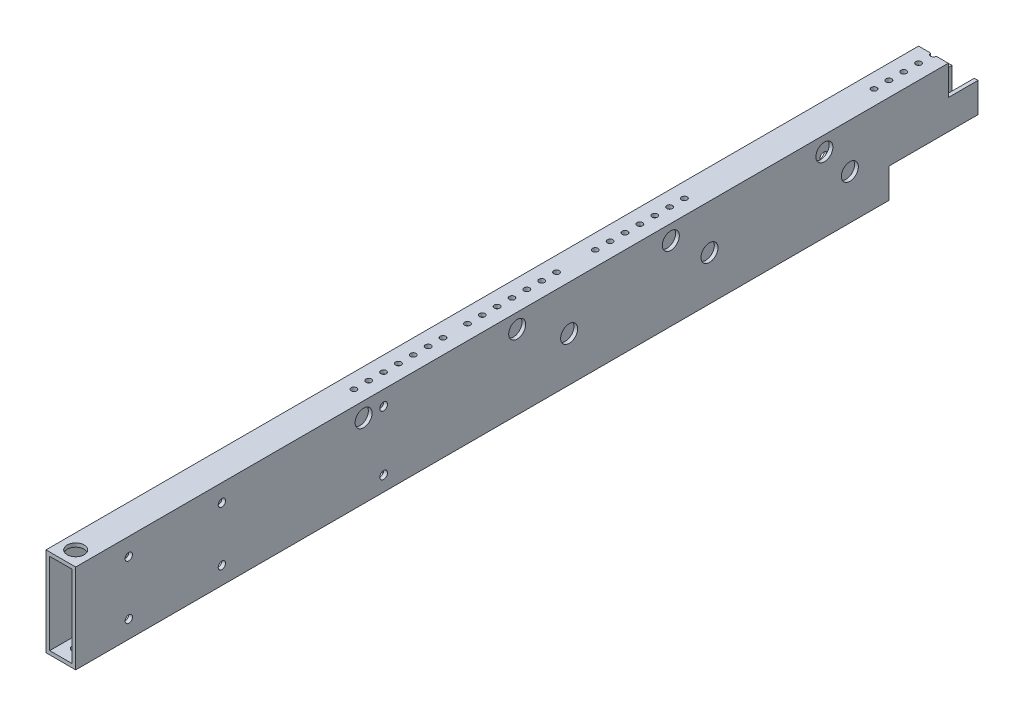
from build123d import *

# Parameters (mm, degrees)
SKETCH1_W                                    = 25.4
SKETCH1_H                                    = 76.2
BOSS_EXTRUDE1_DEPTH                          = 385.699
SHELL1_T                                     = -3.175
SKETCH2_W                                    = 76.2
SKETCH2_H                                    = 25.4
CUT_EXTRUDE1_DEPTH                           = 389.407632007
SKETCH3_W                                    = 25.4
SKETCH3_H                                    = 25.4
CUT_EXTRUDE2_DEPTH                           = 389.407632007
SKETCH4_R                                    = 2.38125
CUT_EXTRUDE3_DEPTH                           = 394.359185225
CUT_EXTRUDE4_REACH                           = 395.359
SKETCH5_R                                    = 2.38125
CUT_EXTRUDE5_REACH                           = 395.359
SKETCH6_R                                    = 2.38125
CBORE_FOR_M6_HEX_HEAD_BOLT1_D                = 6.3
CBORE_FOR_M6_HEX_HEAD_BOLT1_CBORE_D          = 14.547
CBORE_FOR_M6_HEX_HEAD_BOLT1_CBORE_DEPTH      = 4
CBORE_FOR_M6_HEX_HEAD_CAP_SCREW1_D           = 6.6
CBORE_FOR_M6_HEX_HEAD_CAP_SCREW1_CBORE_D     = 14.55
CBORE_FOR_M6_HEX_HEAD_CAP_SCREW1_CBORE_DEPTH = 4.15
CBORE_FOR_M6_HEX_HEAD_CAP_SCREW2_D           = 6.6
CBORE_FOR_M6_HEX_HEAD_CAP_SCREW2_CBORE_D     = 14.55
CBORE_FOR_M6_HEX_HEAD_CAP_SCREW2_CBORE_DEPTH = 4.15
CBORE_FOR_M6_HEX_HEAD_CAP_SCREW3_D           = 6.6
CBORE_FOR_M6_HEX_HEAD_CAP_SCREW3_CBORE_D     = 14.55
CBORE_FOR_M6_HEX_HEAD_CAP_SCREW3_CBORE_DEPTH = 4.15
CBORE_FOR_M6_HEX_HEAD_BOLT2_D                = 6.3
CBORE_FOR_M6_HEX_HEAD_BOLT2_CBORE_D          = 14.547
CBORE_FOR_M6_HEX_HEAD_BOLT2_CBORE_DEPTH      = 4


with BuildPart() as part:
    # Sketch1 → Boss-Extrude1 (new, symmetric)
    with BuildSketch(Plane.XY):
        Rectangle(SKETCH1_W, SKETCH1_H)
    extrude(amount=BOSS_EXTRUDE1_DEPTH, both=True)

    # Shell1
    shell1_openings = [part.faces().sort_by_distance(p)[0] for p in [
        (0, 0, -385.699),
        (0, 0, 385.699),
    ]]
    offset(amount=SHELL1_T, openings=shell1_openings, kind=Kind.INTERSECTION)

    # Sketch2 → Cut-Extrude1 (cut, through all)
    with BuildSketch(Plane(origin=(12.7, 0, 0), x_dir=(0, 0, -1), z_dir=(1, 0, 0))):
        with Locations((347.599, -25.4)):
            Rectangle(SKETCH2_W, SKETCH2_H)
    extrude(amount=-CUT_EXTRUDE1_DEPTH, mode=Mode.SUBTRACT)

    # Sketch3 → Cut-Extrude2 (cut, through all)
    with BuildSketch(Plane(origin=(12.7, 0, 0), x_dir=(0, 0, -1), z_dir=(1, 0, 0))):
        with Locations((372.999, 25.4)):
            Rectangle(SKETCH3_W, SKETCH3_H)
    extrude(amount=-CUT_EXTRUDE2_DEPTH, mode=Mode.SUBTRACT)

    # Sketch4 → Cut-Extrude3 (cut, through all)
    with BuildSketch(Plane(origin=(0, 38.1, 0), x_dir=(1, 0, 0), z_dir=(0, 1, 0))):
        with Locations((0, 147.394483214)):
            Circle(SKETCH4_R)
        with Locations((0, 134.694483214)):
            Circle(SKETCH4_R)
        with Locations((0, 121.994483214)):
            Circle(SKETCH4_R)
        with Locations((0, 109.294483214)):
            Circle(SKETCH4_R)
        with Locations((0, 96.594483214)):
            Circle(SKETCH4_R)
        with Locations((0, 83.894483214)):
            Circle(SKETCH4_R)
        with Locations((0, 71.194483214)):
            Circle(SKETCH4_R)
        with Locations((0, 38.09873)):
            Circle(SKETCH4_R)
        with Locations((0, 25.39873)):
            Circle(SKETCH4_R)
        with Locations((0, 12.69873)):
            Circle(SKETCH4_R)
        with Locations((0, -0.00127)):
            Circle(SKETCH4_R)
        with Locations((0, -12.70127)):
            Circle(SKETCH4_R)
        with Locations((0, -25.40127)):
            Circle(SKETCH4_R)
        with Locations((0, -38.10127)):
            Circle(SKETCH4_R)
        with Locations((0, -58.99324371)):
            Circle(SKETCH4_R)
        with Locations((0, -71.69324371)):
            Circle(SKETCH4_R)
        with Locations((0, -84.39324371)):
            Circle(SKETCH4_R)
        with Locations((0, -97.09324371)):
            Circle(SKETCH4_R)
        with Locations((0, -109.79324371)):
            Circle(SKETCH4_R)
        with Locations((0, -122.49324371)):
            Circle(SKETCH4_R)
        with Locations((0, -135.19324371)):
            Circle(SKETCH4_R)
    extrude(amount=-CUT_EXTRUDE3_DEPTH, mode=Mode.SUBTRACT)

    # Sketch5 → Cut-Extrude4 (cut, up to next)
    with BuildSketch(Plane(origin=(0, 38.1, 0), x_dir=(1, 0, 0), z_dir=(0, 1, 0)), mode=Mode.PRIVATE) as cut_extrude4_sk1:
        with Locations((0, 360.299)):
            Circle(SKETCH5_R)
    cut_extrude4_tool1 = extrude(cut_extrude4_sk1.sketch, amount=-CUT_EXTRUDE4_REACH, mode=Mode.PRIVATE) & part.part
    # Sketch5 → Cut-Extrude4 (cut, up to next)
    with BuildSketch(Plane(origin=(0, 38.1, 0), x_dir=(1, 0, 0), z_dir=(0, 1, 0)), mode=Mode.PRIVATE) as cut_extrude4_sk2:
        with Locations((0, 347.599)):
            Circle(SKETCH5_R)
    cut_extrude4_tool2 = extrude(cut_extrude4_sk2.sketch, amount=-CUT_EXTRUDE4_REACH, mode=Mode.PRIVATE) & part.part
    # Sketch5 → Cut-Extrude4 (cut, up to next)
    with BuildSketch(Plane(origin=(0, 38.1, 0), x_dir=(1, 0, 0), z_dir=(0, 1, 0)), mode=Mode.PRIVATE) as cut_extrude4_sk3:
        with Locations((0, 334.899)):
            Circle(SKETCH5_R)
    cut_extrude4_tool3 = extrude(cut_extrude4_sk3.sketch, amount=-CUT_EXTRUDE4_REACH, mode=Mode.PRIVATE) & part.part
    # Sketch5 → Cut-Extrude4 (cut, up to next)
    with BuildSketch(Plane(origin=(0, 38.1, 0), x_dir=(1, 0, 0), z_dir=(0, 1, 0)), mode=Mode.PRIVATE) as cut_extrude4_sk4:
        with Locations((0, 322.199)):
            Circle(SKETCH5_R)
    cut_extrude4_tool4 = extrude(cut_extrude4_sk4.sketch, amount=-CUT_EXTRUDE4_REACH, mode=Mode.PRIVATE) & part.part
    # Sketch5 → Cut-Extrude4 (cut, up to next)
    with BuildSketch(Plane(origin=(0, 38.1, 0), x_dir=(1, 0, 0), z_dir=(0, 1, 0)), mode=Mode.PRIVATE) as cut_extrude4_sk5:
        with Locations((0, 309.499)):
            Circle(SKETCH5_R)
    cut_extrude4_tool5 = extrude(cut_extrude4_sk5.sketch, amount=-CUT_EXTRUDE4_REACH, mode=Mode.PRIVATE) & part.part
    add(cut_extrude4_tool1.solids().sort_by_distance((0, 38.1, -360.299))[0], mode=Mode.SUBTRACT)
    add(cut_extrude4_tool2.solids().sort_by_distance((0, 38.1, -347.599))[0], mode=Mode.SUBTRACT)
    add(cut_extrude4_tool3.solids().sort_by_distance((0, 38.1, -334.899))[0], mode=Mode.SUBTRACT)
    add(cut_extrude4_tool4.solids().sort_by_distance((0, 38.1, -322.199))[0], mode=Mode.SUBTRACT)
    add(cut_extrude4_tool5.solids().sort_by_distance((0, 38.1, -309.499))[0], mode=Mode.SUBTRACT)

    # Sketch6 → Cut-Extrude5 (cut, up to next)
    with BuildSketch(Plane.XZ.offset(38.1), mode=Mode.PRIVATE) as cut_extrude5_sk1:
        with Locations((0, -309.499)):
            Circle(SKETCH6_R)
    cut_extrude5_tool1 = extrude(cut_extrude5_sk1.sketch, amount=-CUT_EXTRUDE5_REACH, mode=Mode.PRIVATE) & part.part
    # Sketch6 → Cut-Extrude5 (cut, up to next)
    with BuildSketch(Plane.XZ.offset(38.1), mode=Mode.PRIVATE) as cut_extrude5_sk2:
        with Locations((0, -296.799)):
            Circle(SKETCH6_R)
    cut_extrude5_tool2 = extrude(cut_extrude5_sk2.sketch, amount=-CUT_EXTRUDE5_REACH, mode=Mode.PRIVATE) & part.part
    # Sketch6 → Cut-Extrude5 (cut, up to next)
    with BuildSketch(Plane.XZ.offset(38.1), mode=Mode.PRIVATE) as cut_extrude5_sk3:
        with Locations((0, -284.099)):
            Circle(SKETCH6_R)
    cut_extrude5_tool3 = extrude(cut_extrude5_sk3.sketch, amount=-CUT_EXTRUDE5_REACH, mode=Mode.PRIVATE) & part.part
    # Sketch6 → Cut-Extrude5 (cut, up to next)
    with BuildSketch(Plane.XZ.offset(38.1), mode=Mode.PRIVATE) as cut_extrude5_sk4:
        with Locations((0, -258.699)):
            Circle(SKETCH6_R)
    cut_extrude5_tool4 = extrude(cut_extrude5_sk4.sketch, amount=-CUT_EXTRUDE5_REACH, mode=Mode.PRIVATE) & part.part
    # Sketch6 → Cut-Extrude5 (cut, up to next)
    with BuildSketch(Plane.XZ.offset(38.1), mode=Mode.PRIVATE) as cut_extrude5_sk5:
        with Locations((0, -271.399)):
            Circle(SKETCH6_R)
    cut_extrude5_tool5 = extrude(cut_extrude5_sk5.sketch, amount=-CUT_EXTRUDE5_REACH, mode=Mode.PRIVATE) & part.part
    add(cut_extrude5_tool1.solids().sort_by_distance((0, -38.1, -309.499))[0], mode=Mode.SUBTRACT)
    add(cut_extrude5_tool2.solids().sort_by_distance((0, -38.1, -296.799))[0], mode=Mode.SUBTRACT)
    add(cut_extrude5_tool3.solids().sort_by_distance((0, -38.1, -284.099))[0], mode=Mode.SUBTRACT)
    add(cut_extrude5_tool4.solids().sort_by_distance((0, -38.1, -258.699))[0], mode=Mode.SUBTRACT)
    add(cut_extrude5_tool5.solids().sort_by_distance((0, -38.1, -271.399))[0], mode=Mode.SUBTRACT)

    # CBORE for M6 Hex Head Bolt1 (through all)
    with Locations(Plane.ZY.offset(12.7)):
        with Locations((260.7244, 23.1254), (260.7244, -23.1), (340.3244, 23.1254), (340.3244, -23.1)):
            CounterBoreHole(CBORE_FOR_M6_HEX_HEAD_BOLT1_D / 2, CBORE_FOR_M6_HEX_HEAD_BOLT1_CBORE_D / 2, CBORE_FOR_M6_HEX_HEAD_BOLT1_CBORE_DEPTH)

    # CBORE for M6 Hex Head Cap Screw1 (through all)
    with Locations(Plane.ZY.offset(12.7)):
        with Locations((122.46784244, 25.4), (122.46784244, -25.4)):
            CounterBoreHole(CBORE_FOR_M6_HEX_HEAD_CAP_SCREW1_D / 2, CBORE_FOR_M6_HEX_HEAD_CAP_SCREW1_CBORE_D / 2, CBORE_FOR_M6_HEX_HEAD_CAP_SCREW1_CBORE_DEPTH)

    # CBORE for M6 Hex Head Cap Screw2 (through all)
    with Locations(Plane(origin=(0, 38.1, 0), x_dir=(1, 0, 0), z_dir=(0, 1, 0))):
        with Locations((0, -372.999)):
            CounterBoreHole(CBORE_FOR_M6_HEX_HEAD_CAP_SCREW2_D / 2, CBORE_FOR_M6_HEX_HEAD_CAP_SCREW2_CBORE_D / 2, CBORE_FOR_M6_HEX_HEAD_CAP_SCREW2_CBORE_DEPTH)

    # CBORE for M6 Hex Head Cap Screw3 (through all)
    with Locations(Plane(origin=(12.7, 0, 0), x_dir=(0, 0, -1), z_dir=(1, 0, 0))):
        with Locations((36.144871949, 0), (156.144871949, 0), (276.144871949, 0)):
            CounterBoreHole(CBORE_FOR_M6_HEX_HEAD_CAP_SCREW3_D / 2, CBORE_FOR_M6_HEX_HEAD_CAP_SCREW3_CBORE_D / 2, CBORE_FOR_M6_HEX_HEAD_CAP_SCREW3_CBORE_DEPTH)

    # CBORE for M6 Hex Head Bolt2 (through all)
    with Locations(Plane(origin=(12.7, 0, 0), x_dir=(0, 0, -1), z_dir=(1, 0, 0))):
        with Locations((254.381, 25.4), (123.063, 25.4), (-8.255, 25.4), (-139.573, 25.4)):
            CounterBoreHole(CBORE_FOR_M6_HEX_HEAD_BOLT2_D / 2, CBORE_FOR_M6_HEX_HEAD_BOLT2_CBORE_D / 2, CBORE_FOR_M6_HEX_HEAD_BOLT2_CBORE_DEPTH)


solid = part.part
